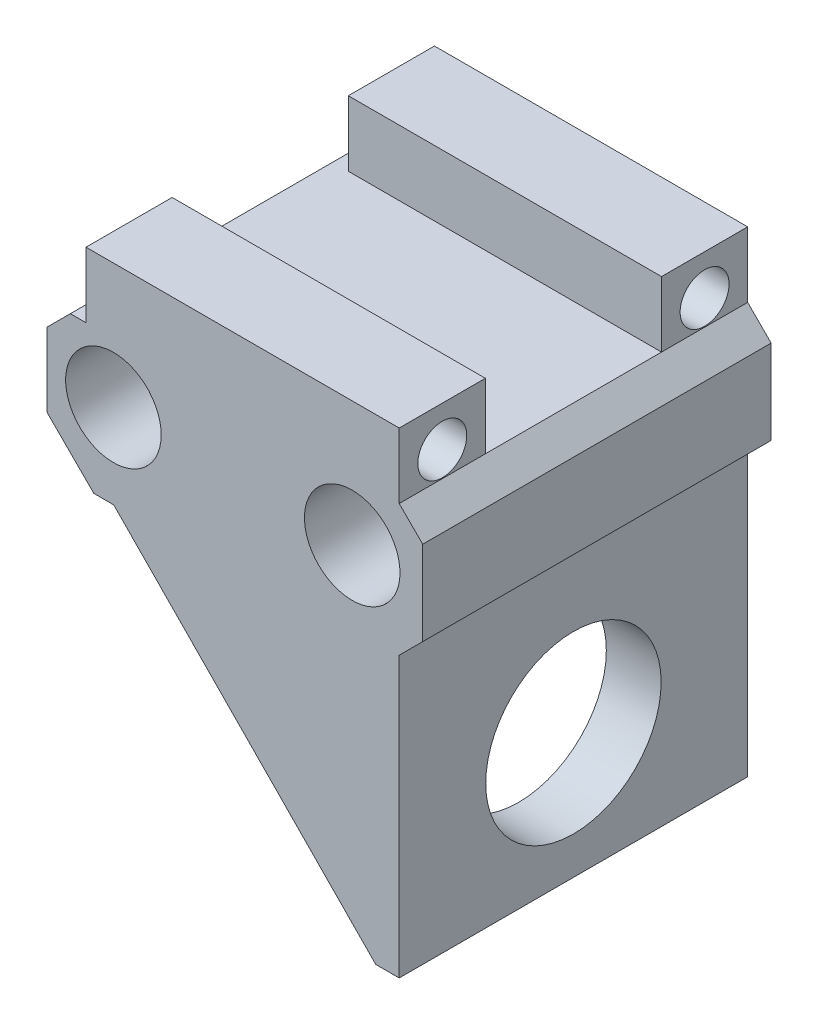
from build123d import *
from build123d.topology import SkipClean

# Parameters (mm, degrees)
SKETCH1_W            = 42.5
SKETCH1_H            = 55.85
BOSS_EXTRUDE2_DEPTH  = 42.5
SKETCH5_R            = 3.175
CUT_EXTRUDE2_DEPTH   = 42.5
SKETCH6_W            = 42.5
SKETCH6_H            = 42.5
CUT_EXTRUDE3_DEPTH   = 39.5
SKETCH7_R            = 12
SKETCH7_R_2          = 1.5
CUT_EXTRUDE4_DEPTH   = 39.5
SKETCH9_W            = 10
SKETCH9_H            = 42.5
CUT_EXTRUDE5_DEPTH   = 39.5
CHAMFER1_SIZE        = 3
CHAMFER2_SIZE        = 2
SKETCH10_W           = 2
SKETCH10_H           = 2.12759362
BOSS_EXTRUDE3_DEPTH  = 3
SKETCH12_W           = 2
SKETCH12_H           = 3
BOSS_EXTRUDE4_DEPTH  = 3
BOSS_EXTRUDE5_DEPTH  = 2
BOSS_EXTRUDE6_DEPTH  = 2
SKETCH16_W           = 9
SKETCH16_H           = 14.17
SKETCH16_R           = 3.125
BOSS_EXTRUDE8_DEPTH  = 5
SKETCH18_W           = 9
SKETCH18_H           = 12.353282928
BOSS_EXTRUDE9_DEPTH  = 2
SKETCH20_W           = 36.5
SKETCH20_H           = 45.261647475
CUT_EXTRUDE9_DEPTH   = 66
CUT_EXTRUDE10_DEPTH  = 66
SKETCH22_R           = 12.5
SKETCH22_R_2         = 11.2
SKETCH22_R_3         = 2
BOSS_EXTRUDE13_DEPTH = 3
SKETCH23_W           = 42.5
SKETCH23_H           = 7.37509362
CUT_EXTRUDE11_DEPTH  = 3
CHAMFER3_SIZE        = 2
SKETCH24_R           = 13.75
SKETCH24_R_2         = 11.2
BOSS_EXTRUDE14_DEPTH = 4
BOSS_EXTRUDE15_DEPTH = 2.5
BOSS_EXTRUDE16_DEPTH = 2.5
SKETCH28_W           = 3
SKETCH28_H           = 2
BOSS_EXTRUDE17_DEPTH = 42.5
SKETCH29_W           = 1
SKETCH29_H           = 12.353282928
BOSS_EXTRUDE18_DEPTH = 7
BOSS_EXTRUDE19_START = 1
SKETCH31_R           = 3.175
BOSS_EXTRUDE19_DEPTH = 1
SKETCH32_R           = 3.175
BOSS_EXTRUDE20_DEPTH = 1
BOSS_EXTRUDE21_DEPTH = 1
SKETCH34_W           = 11
SKETCH34_H           = 8.5
SKETCH34_R           = 3.125
SKETCH34_H_2         = 13.67
BOSS_EXTRUDE22_DEPTH = 40
SKETCH35_R           = 3.125
CUT_EXTRUDE13_DEPTH  = 52
BOSS_EXTRUDE23_DEPTH = 11
SKETCH37_W           = 22.5
SKETCH37_H           = 4
BOSS_EXTRUDE24_DEPTH = 43
SKETCH38_W           = 3.111297042
SKETCH38_H           = 14.426321109
BOSS_EXTRUDE25_DEPTH = 44.5
SKETCH39_W           = 1.127935157
SKETCH39_H           = 1.723234268
BOSS_EXTRUDE26_DEPTH = 44.5
BOSS_EXTRUDE27_DEPTH = 44.5
SKETCH42_W           = 2
SKETCH42_H           = 16.771333713
BOSS_EXTRUDE28_DEPTH = 44.5
CHAMFER4_SIZE        = 2
CHAMFER5_SIZE        = 3
SKETCH40_R           = 6.1
CUT_EXTRUDE14_DEPTH  = 44.5
CHAMFER6_SIZE        = 6
SKETCH44_W           = 37.5
SKETCH44_H           = 3.156682669
BOSS_EXTRUDE32_DEPTH = 38.5
SKETCH45_W           = 2.465771705
SKETCH45_H           = 2.227148637
BOSS_EXTRUDE33_DEPTH = 44.5
BOSS_EXTRUDE34_DEPTH = 44.5


with BuildPart() as part:
    # Sketch1 → Boss-Extrude2 (new body)
    with BuildSketch(Plane.XY):
        with Locations((-16.653499003, 3.960644895)):
            Rectangle(SKETCH1_W, SKETCH1_H)
    extrude(amount=BOSS_EXTRUDE2_DEPTH)

    # Sketch5 → Cut-Extrude2 (cut)
    with BuildSketch(Plane.XY.offset(42.5)):
        with Locations((-31.903499003, 25.965832134)):
            Circle(SKETCH5_R)
        with Locations(Location((-1.403499003, 25.965832134, 0), (0, 0, 180))):
            Circle(SKETCH5_R)
    extrude(amount=-CUT_EXTRUDE2_DEPTH, mode=Mode.SUBTRACT)

    # Sketch6 → Cut-Extrude3 (cut)
    with BuildSketch(Plane.ZY.offset(37.903499003)):
        with Locations((21.25, -0.586761485)):
            Rectangle(SKETCH6_W, SKETCH6_H)
    extrude(amount=-CUT_EXTRUDE3_DEPTH, mode=Mode.SUBTRACT)

    # Sketch7 → Cut-Extrude4 (cut)
    with BuildSketch(Plane(origin=(4.596500997, 0, 0), x_dir=(0, 0, -1), z_dir=(1, 0, 0))):
        with Locations((-21.25, -0.586761485)):
            Circle(SKETCH7_R)
        with Locations((-37, -16.336761485)):
            Circle(SKETCH7_R_2)
        with Locations((-5.5, -16.336761485)):
            Circle(SKETCH7_R_2)
        with Locations((-37, 14.663238515)):
            Circle(SKETCH7_R_2)
        with Locations((-5.5, 14.663238515)):
            Circle(SKETCH7_R_2)
    extrude(amount=-CUT_EXTRUDE4_DEPTH, mode=Mode.SUBTRACT)

    # Sketch9 → Cut-Extrude5 (cut)
    with BuildSketch(Plane.XZ.offset(23.964355105)):
        with Locations((-32.903499003, 21.25)):
            Rectangle(SKETCH9_W, SKETCH9_H)
    extrude(amount=-CUT_EXTRUDE5_DEPTH, mode=Mode.SUBTRACT)

    # Chamfer1
    chamfer1_edges = [part.edges().sort_by_distance(p)[0] for p in [
        (-37.903499003, 20.663238515, 21.25),
        (-37.903499003, 31.885644895, 21.25),
    ]]
    chamfer(chamfer1_edges, length=CHAMFER1_SIZE)

    # Chamfer2
    chamfer2_edges = [part.edges().sort_by_distance(p)[0] for p in [
        (4.596500997, -23.964355105, 21.25),
    ]]
    chamfer(chamfer2_edges, length=CHAMFER2_SIZE)

    # Sketch10 → Boss-Extrude3 (add)
    with BuildSketch(Plane.ZY.offset(27.903499003)):
        with Locations((43.5, -22.900558295)):
            Rectangle(SKETCH10_W, SKETCH10_H)
        with Locations((-1, -22.900558295)):
            Rectangle(SKETCH10_W, SKETCH10_H)
    extrude(amount=-BOSS_EXTRUDE3_DEPTH)

    # Sketch12 → Boss-Extrude4 (add)
    with BuildSketch(Plane.ZY.offset(-1.596500997)):
        with Locations((43.5, 19.163238515)):
            Rectangle(SKETCH12_W, SKETCH12_H)
        with Locations((-1, 19.163238515)):
            Rectangle(SKETCH12_W, SKETCH12_H)
    extrude(amount=-BOSS_EXTRUDE4_DEPTH)

    # Sketch13 → Boss-Extrude5 (add)
    with BuildSketch(Plane(origin=(0, 0, -2), x_dir=(-1, 0, 0), z_dir=(0, 0, -1))):
        Polygon((-1.596500997, 17.663238515), (24.903499003, -21.836761485), (27.903499003, -21.836761485), (-1.596500997, 20.663238515), align=None)
    extrude(amount=-BOSS_EXTRUDE5_DEPTH)

    # Sketch14 → Boss-Extrude6 (add)
    with BuildSketch(Plane.XY.offset(44.5)):
        Polygon((1.596500997, 17.663238515), (-24.903499003, -21.836761485), (-27.903499003, -21.836761485), (1.596500997, 20.663238515), align=None)
    extrude(amount=-BOSS_EXTRUDE6_DEPTH)

    # Sketch16 → Boss-Extrude8 (add)
    # profile 1 of 2: a face of its own
    with BuildSketch(Plane(origin=(4.596500997, 0, 0), x_dir=(0, 0, -1), z_dir=(1, 0, 0))):
        with Locations((-38, 37.153927823)):
            Rectangle(SKETCH16_W, SKETCH16_H)
        with Locations((-38, 39.113927823)):
            Circle(SKETCH16_R, mode=Mode.SUBTRACT)
    # profile 2 of 2: a face of its own
    with BuildSketch(Plane(origin=(4.596500997, 0, 0), x_dir=(0, 0, -1), z_dir=(1, 0, 0))):
        with Locations((-4.5, 37.153927823)):
            Rectangle(SKETCH16_W, SKETCH16_H)
        with Locations(Location((-4.5, 39.113927823, 0), (0, 0, 180))):
            Circle(SKETCH16_R, mode=Mode.SUBTRACT)
    extrude(amount=-BOSS_EXTRUDE8_DEPTH)

    # Sketch18 → Boss-Extrude9 (add)
    with BuildSketch(Plane.ZY.offset(0.403499003)):
        with Locations((4.5, 38.062286359)):
            Rectangle(SKETCH18_W, SKETCH18_H)
        with Locations((38, 38.062286359)):
            Rectangle(SKETCH18_W, SKETCH18_H)
    extrude(amount=BOSS_EXTRUDE9_DEPTH)

    # Sketch20 → Cut-Extrude9 (cut, symmetric)
    with BuildSketch(Plane.XY.offset(42.5)):
        with Locations((-16.653499003, -1.967585223)):
            Rectangle(SKETCH20_W, SKETCH20_H)
    extrude(amount=CUT_EXTRUDE9_DEPTH, both=True, mode=Mode.SUBTRACT)

    # Sketch21 → Cut-Extrude10 (cut, symmetric)
    with BuildSketch(Plane(origin=(4.596500997, 0, 0), x_dir=(0, 0, -1), z_dir=(1, 0, 0))):
        Polygon((0, 44.238927823), (0, -21.964355105), (2.461652374, -21.964355105), (3.037977258, 44.238927823), (0.568013469, 44.238927823), align=None)
        Polygon((-42.5, 44.238927823), (-42.5, -21.964355105), (-44.961652374, -21.964355105), (-45.537977258, 44.238927823), (-43.068013469, 44.238927823), align=None)
    extrude(amount=CUT_EXTRUDE10_DEPTH, both=True, mode=Mode.SUBTRACT)

    # Sketch22 → Boss-Extrude13 (add)
    # profile 1 of 5: a face of its own
    with BuildSketch(Plane(origin=(4.596500997, 0, 0), x_dir=(0, 0, -1), z_dir=(1, 0, 0))):
        with Locations((-21.25, -0.499261485)):
            Circle(SKETCH22_R)
        with Locations((-21.25, -0.589261485)):
            Circle(SKETCH22_R_2, mode=Mode.SUBTRACT)
    # profile 2 of 5: a face of its own
    with BuildSketch(Plane(origin=(4.596500997, 0, 0), x_dir=(0, 0, -1), z_dir=(1, 0, 0))):
        with Locations((-37, 14.663238515)):
            Circle(SKETCH22_R_3)
    # profile 3 of 5: a face of its own
    with BuildSketch(Plane(origin=(4.596500997, 0, 0), x_dir=(0, 0, -1), z_dir=(1, 0, 0))):
        with Locations((-5.524563877, 14.750738515)):
            Circle(SKETCH22_R_3)
    # profile 4 of 5: a face of its own
    with BuildSketch(Plane(origin=(4.596500997, 0, 0), x_dir=(0, 0, -1), z_dir=(1, 0, 0))):
        with Locations((-5.5, -16.336761485)):
            Circle(SKETCH22_R_3)
    # profile 5 of 5: a face of its own
    with BuildSketch(Plane(origin=(4.596500997, 0, 0), x_dir=(0, 0, -1), z_dir=(1, 0, 0))):
        with Locations((-37, -16.336761485)):
            Circle(SKETCH22_R_3)
    extrude(amount=-BOSS_EXTRUDE13_DEPTH)

    # Sketch23 → Cut-Extrude11 (cut)
    with BuildSketch(Plane(origin=(4.596500997, 0, 0), x_dir=(0, 0, -1), z_dir=(1, 0, 0))):
        with Locations((-21.25, -20.276808295)):
            Rectangle(SKETCH23_W, SKETCH23_H)
    extrude(amount=-CUT_EXTRUDE11_DEPTH, mode=Mode.SUBTRACT)

    # Chamfer3
    chamfer3_edges = [part.edges().sort_by_distance(p)[0] for p in [
        (4.596500997, -16.589261485, 21.25),
    ]]
    chamfer(chamfer3_edges, length=CHAMFER3_SIZE)

    # Sketch24 → Boss-Extrude14 (add)
    with BuildSketch(Plane.ZY.offset(-1.596500997)):
        with Locations(Location((21.25, -0.589261485, 0), (0, 0, 180))):
            Circle(SKETCH24_R)
        with Locations(Location((21.25, -0.589261485, 0), (0, 0, 180))):
            Circle(SKETCH24_R_2, mode=Mode.SUBTRACT)
    extrude(amount=BOSS_EXTRUDE14_DEPTH)

    # Sketch25 → Boss-Extrude15 (add)
    with BuildSketch(Plane.XY.offset(42.5)):
        Polygon((-34.903499003, 20.663238515), (1.596500997, -16.589261485), (1.596500997, 20.663238515), align=None)
    extrude(amount=-BOSS_EXTRUDE15_DEPTH)

    # Sketch26 → Boss-Extrude16 (add)
    with BuildSketch(Plane(origin=(0, 0, 0), x_dir=(-1, 0, 0), z_dir=(0, 0, -1))):
        Polygon((-1.596500997, 20.663238515), (-1.596500997, -16.589261485), (34.903499003, 20.663238515), align=None)
    extrude(amount=-BOSS_EXTRUDE16_DEPTH)

    # Sketch28 → Boss-Extrude17 (add)
    with BuildSketch(Plane.XY.offset(42.5)):
        with Locations((3.096500997, -15.589261485)):
            Rectangle(SKETCH28_W, SKETCH28_H)
    extrude(amount=-BOSS_EXTRUDE17_DEPTH)

    # Sketch29 → Boss-Extrude18 (add)
    with BuildSketch(Plane(origin=(4.596500997, 0, 0), x_dir=(0, 0, -1), z_dir=(1, 0, 0))):
        with Locations((-33, 38.062286359)):
            Rectangle(SKETCH29_W, SKETCH29_H)
        with Locations((-9.5, 38.062286359)):
            Rectangle(SKETCH29_W, SKETCH29_H)
    extrude(amount=-BOSS_EXTRUDE18_DEPTH)

    # Sketch31 → Boss-Extrude19 (add)
    with BuildSketch(Plane.XY.offset(42.5).offset(BOSS_EXTRUDE19_START)):
        Polygon((-37.903499003, 28.885644895), (-37.903499003, 23.663238515), (1.596500997, -16.589261485), (4.596500997, -16.589261485), (4.596500997, 44.238927823), (-2.403499003, 44.238927823), (-2.403499003, 31.885644895), (-34.903499003, 31.885644895), align=None)
        with Locations((-31.903499003, 25.965832134)):
            Circle(SKETCH31_R, mode=Mode.SUBTRACT)
        with Locations((-1.403499003, 25.965832134)):
            Circle(SKETCH31_R, mode=Mode.SUBTRACT)
    extrude(amount=-BOSS_EXTRUDE19_DEPTH)

    # Sketch32 → Boss-Extrude20 (add)
    with BuildSketch(Plane(origin=(0, 0, 0), x_dir=(-1, 0, 0), z_dir=(0, 0, -1))):
        Polygon((-4.596500997, 44.238927823), (-4.596500997, -16.589261485), (-1.596500997, -16.589261485), (37.903499003, 23.663238515), (37.903499003, 28.885644895), (34.903499003, 31.885644895), (2.403499003, 31.885644895), (2.403499003, 44.238927823), align=None)
        with Locations(Location((1.403499003, 25.965832134, 0), (0, 0, 180))):
            Circle(SKETCH32_R, mode=Mode.SUBTRACT)
        with Locations(Location((31.903499003, 25.965832134, 0), (0, 0, 180))):
            Circle(SKETCH32_R, mode=Mode.SUBTRACT)
    extrude(amount=BOSS_EXTRUDE20_DEPTH)

    # Sketch33 → Boss-Extrude21 (add)
    with BuildSketch(Plane(origin=(-7.479841124, -7.340009301, 0), x_dir=(0, 0, 1), z_dir=(-0.7137468745682252, -0.7004037400272006, 0))):
        Polygon((-1, 43.437314994), (-1, -12.958728806), (2.5, -12.958728806), (2.5, 39.19486315), (40, 39.19486315), (40, -12.958728806), (43.5, -12.958728806), (43.5, 43.437314994), align=None)
    extrude(amount=-BOSS_EXTRUDE21_DEPTH)

    # Sketch34 → Boss-Extrude22 (add)
    # profile 1 of 2: a face of its own
    with BuildSketch(Plane(origin=(4.596500997, 0, 0), x_dir=(0, 0, -1), z_dir=(1, 0, 0))):
        with Locations((-38, 39.988927823)):
            Rectangle(SKETCH34_W, SKETCH34_H)
        with Locations((-38, 39.113927823)):
            Circle(SKETCH34_R, mode=Mode.SUBTRACT)
    # profile 2 of 2: a face of its own
    with BuildSketch(Plane(origin=(4.596500997, 0, 0), x_dir=(0, 0, -1), z_dir=(1, 0, 0))):
        with Locations((-4.5, 37.403927823)):
            Rectangle(SKETCH34_W, SKETCH34_H_2)
        with Locations(Location((-4.5, 39.113927823, 0), (0, 0, 180))):
            Circle(SKETCH34_R, mode=Mode.SUBTRACT)
    extrude(amount=-BOSS_EXTRUDE22_DEPTH)

    # Sketch35 → Cut-Extrude13 (cut)
    with BuildSketch(Plane(origin=(4.596500997, 0, 0), x_dir=(0, 0, -1), z_dir=(1, 0, 0))):
        with Locations((-38, 39.113927823)):
            Circle(SKETCH35_R)
        with Locations((-4.5, 39.113927823)):
            Circle(SKETCH35_R)
    extrude(amount=-CUT_EXTRUDE13_DEPTH, mode=Mode.SUBTRACT)

    # Sketch36 → Boss-Extrude23 (add)
    with BuildSketch(Plane.XY.offset(43.5)):
        Polygon((-35.403499003, 35.738927823), (-35.403499003, 31.385644895), (-34.903499003, 31.885644895), (-2.403499003, 31.885644895), (-2.403499003, 35.738927823), align=None)
    extrude(amount=-BOSS_EXTRUDE23_DEPTH)

    # Sketch37 → Boss-Extrude24 (add)
    with BuildSketch(Plane(origin=(4.596500997, 0, 0), x_dir=(0, 0, -1), z_dir=(1, 0, 0))):
        with Locations((-21.25, 33.885644895)):
            Rectangle(SKETCH37_W, SKETCH37_H)
    extrude(amount=-BOSS_EXTRUDE24_DEPTH)

    # Sketch38 → Boss-Extrude25 (add)
    with BuildSketch(Plane.XY.offset(43.5)):
        with Locations((-36.847850482, 28.672484341)):
            Rectangle(SKETCH38_W, SKETCH38_H)
    extrude(amount=-BOSS_EXTRUDE25_DEPTH)

    # Sketch39 → Boss-Extrude26 (add)
    with BuildSketch(Plane(origin=(0, 0, -1), x_dir=(-1, 0, 0), z_dir=(0, 0, -1))):
        with Locations((35.21666709, 31.599834129)):
            Rectangle(SKETCH39_W, SKETCH39_H)
    extrude(amount=-BOSS_EXTRUDE26_DEPTH)

    # Sketch41 → Boss-Extrude27 (add)
    with BuildSketch(Plane.XY.offset(43.5)):
        Polygon((-38.403499003, 35.885644895), (-40.403499003, 35.885644895), (-40.403499003, 21.459323786), (-40.403499003, 17.506555846), (-31.861912383, 17.506555846), (-35.740785337, 21.459323786), (-38.403499003, 21.459323786), align=None)
    extrude(amount=-BOSS_EXTRUDE27_DEPTH)

    # Sketch42 → Boss-Extrude28 (add)
    with BuildSketch(Plane.XY.offset(43.5)):
        with Locations((5.596500997, 27.499978039)):
            Rectangle(SKETCH42_W, SKETCH42_H)
    extrude(amount=-BOSS_EXTRUDE28_DEPTH)

    # Chamfer4
    chamfer4_edges = [part.edges().sort_by_distance(p)[0] for p in [
        (6.596500997, 19.114311182, 21.25),
        (6.596500997, 35.885644895, 21.25),
    ]]
    chamfer(chamfer4_edges, length=CHAMFER4_SIZE - 0.0001)  # a hair under: the kernel refuses the full size

    # Chamfer5
    chamfer5_edges = [part.edges().sort_by_distance(p)[0] for p in [
        (-40.403499003, 35.885644895, 21.25),
    ]]
    chamfer(chamfer5_edges, length=CHAMFER5_SIZE)

    # Sketch40 → Cut-Extrude14 (cut)
    with BuildSketch(Plane.XY.offset(43.5)):
        with Locations((-31.903499003, 28.265832134)):
            Circle(SKETCH40_R)
        with Locations((-1.403499003, 28.265832134)):
            Circle(SKETCH40_R)
    extrude(amount=-CUT_EXTRUDE14_DEPTH, mode=Mode.SUBTRACT)

    # Chamfer6
    chamfer6_edges = [part.edges().sort_by_distance(p)[0] for p in [
        (-40.403499003, 17.506555846, 21.25),
    ]]
    chamfer(chamfer6_edges, length=CHAMFER6_SIZE)

    # Sketch44 → Boss-Extrude32 (add)
    with BuildSketch(Plane(origin=(4.596500997, 0, 0), x_dir=(0, 0, -1), z_dir=(1, 0, 0))):
        with Locations((-21.25, 19.084897181)):
            Rectangle(SKETCH44_W, SKETCH44_H)
    extrude(amount=-BOSS_EXTRUDE32_DEPTH)

    # Sketch45 → Boss-Extrude33 (add)
    with BuildSketch(Plane.XY.offset(43.5)):
        with Locations((-34.362753496, 20.148344478)):
            Rectangle(SKETCH45_W, SKETCH45_H)
    extrude(amount=-BOSS_EXTRUDE33_DEPTH)

    # Sketch47 → Boss-Extrude34 (add)
    with SkipClean():  # the faces are left unmerged after this step: merging them gives an invalid solid
        with BuildSketch(Plane.XY.offset(43.5)):
            Polygon((6.596500997, 33.885644895), (7.596500997, 32.885644895), (7.596500997, 22.114311182), (6.596500997, 21.114311182), align=None)
        extrude(amount=-BOSS_EXTRUDE34_DEPTH)


solid = part.part
